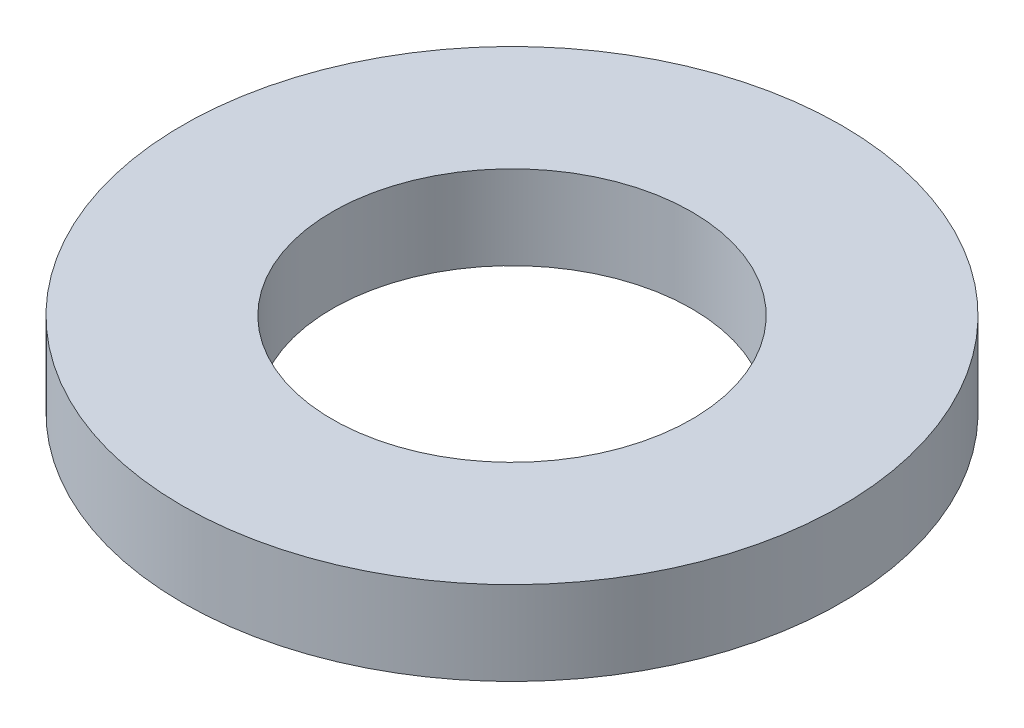
from build123d import *

# Parameters (mm, degrees)
SKETCH1_R           = 82.5
BOSS_EXTRUDE1_DEPTH = 21
SKETCH2_R           = 45
CUT_EXTRUDE1_DEPTH  = 119.547458851


with BuildPart() as part:
    # Sketch1 → Boss-Extrude1 (new body)
    with BuildSketch(Plane(origin=(0, 0, 0), x_dir=(1, 0, 0), z_dir=(0, 1, 0))):
        Circle(SKETCH1_R)
    extrude(amount=BOSS_EXTRUDE1_DEPTH)

    # Sketch2 → Cut-Extrude1 (cut, through all)
    with BuildSketch(Plane(origin=(0, 0, 0), x_dir=(1, 0, 0), z_dir=(0, 1, 0))):
        Circle(SKETCH2_R)
    extrude(amount=CUT_EXTRUDE1_DEPTH, mode=Mode.SUBTRACT)


solid = part.part
